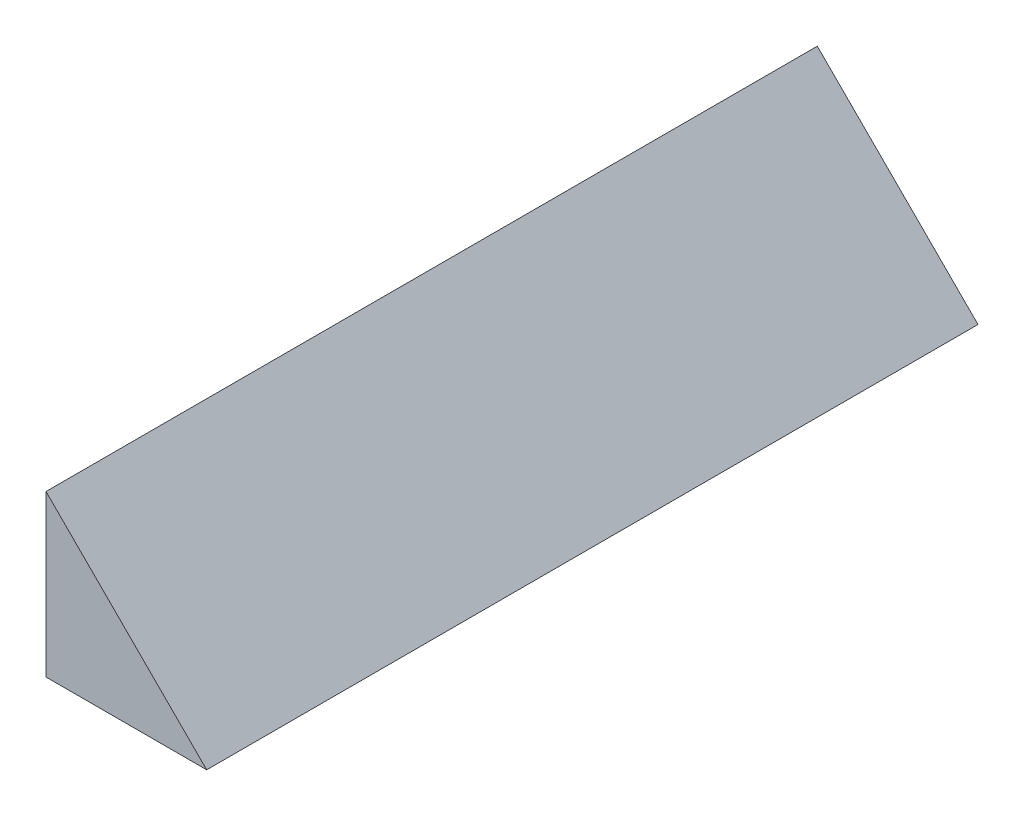
from build123d import *

# Parameters (mm, degrees)
SKETCH_1_W      = 5
SKETCH_1_H      = 5
EXTRUDE_1_DEPTH = 24
CHAMFER_1_SIZE  = 5


with BuildPart() as part:
    # ｽｹｯﾁ1 → ﾎﾞｽ - 押し出し1 (new body)
    with BuildSketch(Plane.XY):
        with Locations((2.5, 2.5)):
            Rectangle(SKETCH_1_W, SKETCH_1_H)
    extrude(amount=EXTRUDE_1_DEPTH)

    # 面取り1
    chamfer_1_edges = [part.edges().sort_by_distance(p)[0] for p in [
        (5, 5, 12),
    ]]
    chamfer(chamfer_1_edges, length=CHAMFER_1_SIZE - 0.0001)  # a hair under: the kernel refuses the full size


solid = part.part
